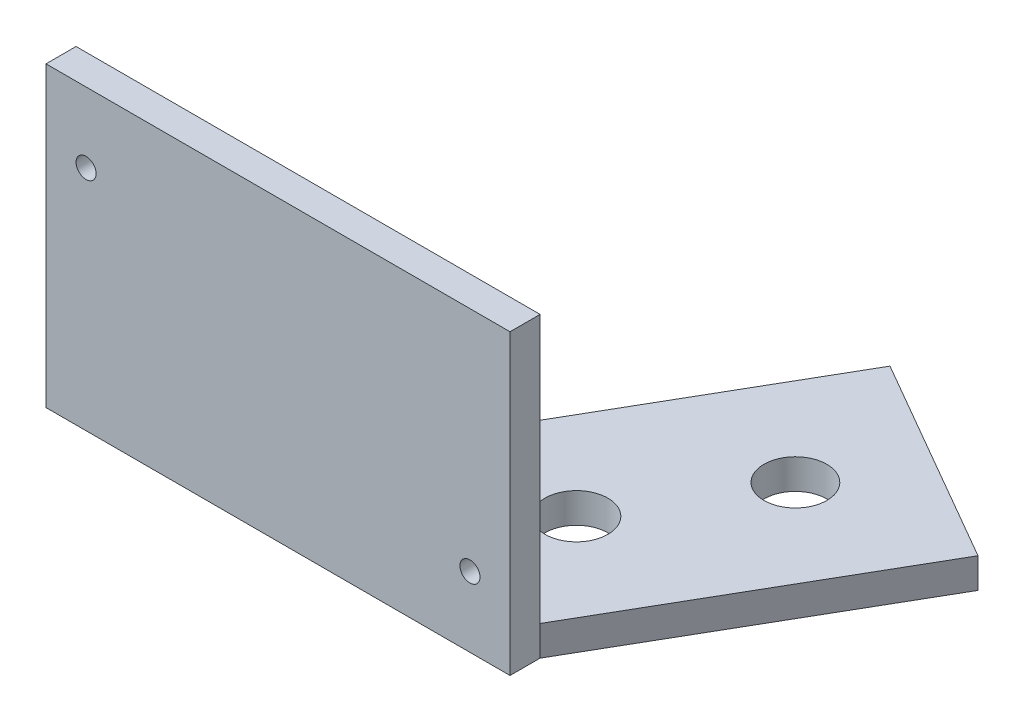
from build123d import *

# Parameters (mm, degrees)
SKETCH1_W           = 36.7665
SKETCH1_H           = 21.209
SKETCH1_R           = 0.79375
BOSS_EXTRUDE1_DEPTH = 2.38125
BOSS_EXTRUDE3_DEPTH = 2.38125
CUT_EXTRUDE2_REACH  = 63.271
SKETCH4_R           = 2.4892


with BuildPart() as part:
    # Sketch1 → Boss-Extrude1 (new body)
    with BuildSketch(Plane.XY):
        with Locations((16.98625, 9.2075)):
            Rectangle(SKETCH1_W, SKETCH1_H)
        with Locations((1.778, 14.25575)):
            Circle(SKETCH1_R, mode=Mode.SUBTRACT)
        with Locations((32.1945, 1.778)):
            Circle(SKETCH1_R, mode=Mode.SUBTRACT)
    extrude(amount=BOSS_EXTRUDE1_DEPTH)

    # Sketch2 → Boss-Extrude3 (add)
    with BuildSketch(Plane.XZ.offset(1.397)):
        Polygon((-1.397, 2.38125), (35.3695, 2.38125), (35.3695, 0), (48.0695, -21.997045256), (31.571716058, -31.522045256), (13.372454744, 0), (-1.397, 0), align=None)
    extrude(amount=BOSS_EXTRUDE3_DEPTH)

    # Sketch4 → Cut-Extrude2 (cut, up to next)
    with BuildSketch(Plane(origin=(0, -1.397, 0), x_dir=(1, 0, 0), z_dir=(0, 1, 0)), mode=Mode.PRIVATE) as cut_extrude2_sk1:
        with Locations((35.800977372, 19.797340731)):
            Circle(SKETCH4_R)
    cut_extrude2_tool1 = extrude(cut_extrude2_sk1.sketch, amount=-CUT_EXTRUDE2_REACH, mode=Mode.PRIVATE) & part.part
    # Sketch4 → Cut-Extrude2 (cut, up to next)
    with BuildSketch(Plane(origin=(0, -1.397, 0), x_dir=(1, 0, 0), z_dir=(0, 1, 0)), mode=Mode.PRIVATE) as cut_extrude2_sk2:
        with Locations((29.450977372, 8.798818102)):
            Circle(SKETCH4_R)
    cut_extrude2_tool2 = extrude(cut_extrude2_sk2.sketch, amount=-CUT_EXTRUDE2_REACH, mode=Mode.PRIVATE) & part.part
    add(cut_extrude2_tool1.solids().sort_by_distance((35.800977, -1.397, -19.797341))[0], mode=Mode.SUBTRACT)
    add(cut_extrude2_tool2.solids().sort_by_distance((29.450977, -1.397, -8.798818))[0], mode=Mode.SUBTRACT)


solid = part.part
